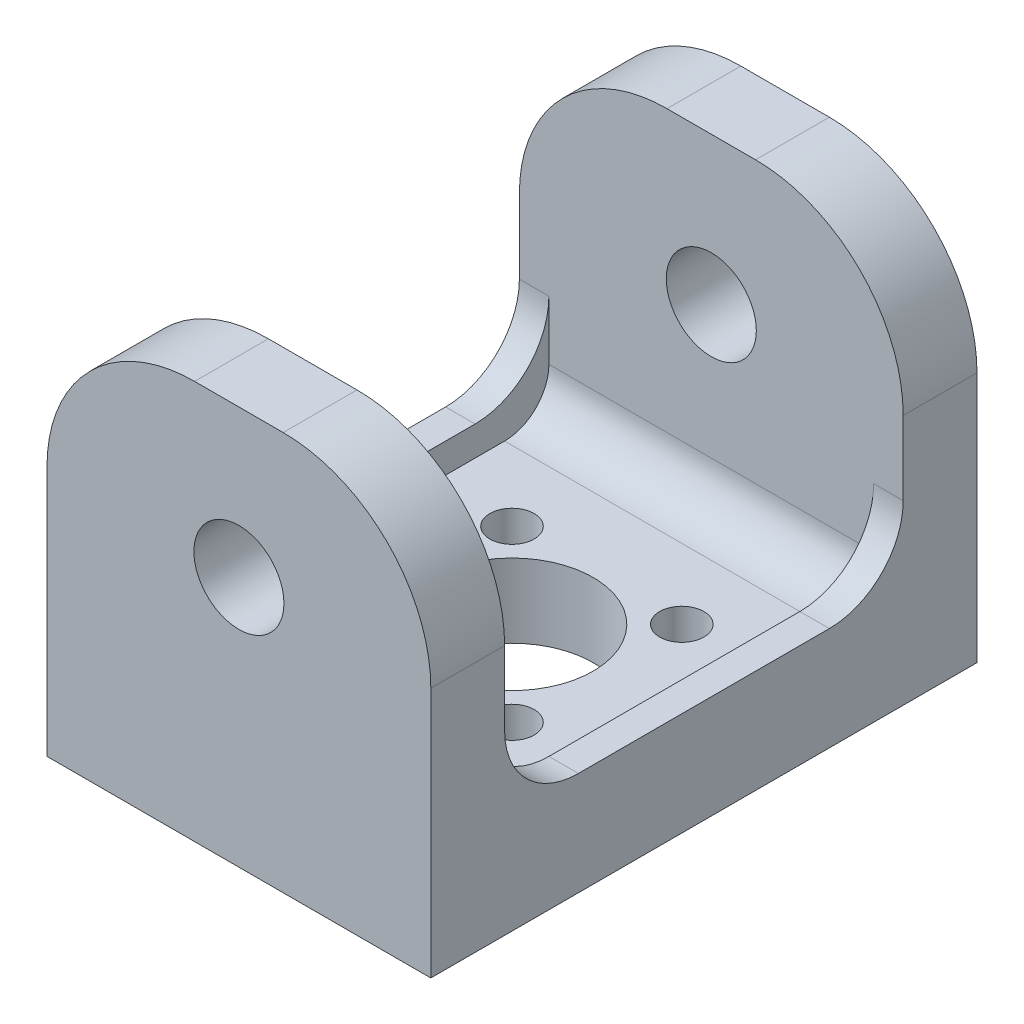
from build123d import *

# Parameters (mm, degrees)
SKETCH1_W               = 26
SKETCH1_H               = 37
BOSS_EXTRUDE1_DEPTH     = 5
SKETCH2_R               = 1.5
SKETCH2_R_2             = 5.5
CUT_EXTRUDE1_DEPTH      = 24.157072354
SKETCH3_W               = 26
SKETCH3_H               = 5
BOSS_EXTRUDE2_DEPTH     = 27
CUT_EXTRUDE2_DEPTH      = 36.217183306
CUT_EXTRUDE2_DEPTH_BACK = 36.217183306
SKETCH4_R               = 3.05
FILLET1_R               = 10
FILLET2_R               = 3
SKETCH5_W               = 2
SKETCH5_H               = 37
BOSS_EXTRUDE3_DEPTH     = 7
FILLET3_R               = 5


with BuildPart() as part:
    # Sketch1 → Boss-Extrude1 (new body)
    with BuildSketch(Plane(origin=(0, 0, 0), x_dir=(1, 0, 0), z_dir=(0, 1, 0))):
        Rectangle(SKETCH1_W, SKETCH1_H)
    extrude(amount=BOSS_EXTRUDE1_DEPTH)

    # Sketch2 → Cut-Extrude1 (cut, through all)
    with BuildSketch(Plane(origin=(0, 0, 0), x_dir=(1, 0, 0), z_dir=(0, 1, 0))):
        with Locations(Location((-5.75, 5.75, 0), (0, 0, 270))):
            Circle(SKETCH2_R)
        with Locations(Location((0, 0, 0), (0, 0, 270))):
            Circle(SKETCH2_R_2)
        with Locations(Location((5.75, 5.75, 0), (0, 0, 270))):
            Circle(SKETCH2_R)
        with Locations(Location((5.75, -5.75, 0), (0, 0, 270))):
            Circle(SKETCH2_R)
        with Locations(Location((-5.75, -5.75, 0), (0, 0, 270))):
            Circle(SKETCH2_R)
    extrude(amount=CUT_EXTRUDE1_DEPTH, mode=Mode.SUBTRACT)

    # Sketch3 → Boss-Extrude2 (add)
    with BuildSketch(Plane(origin=(0, 0, 0), x_dir=(1, 0, 0), z_dir=(0, 1, 0))):
        with Locations((0, 16)):
            Rectangle(SKETCH3_W, SKETCH3_H)
        with Locations((0, -16)):
            Rectangle(SKETCH3_W, SKETCH3_H)
    extrude(amount=BOSS_EXTRUDE2_DEPTH)

    # Sketch4 → Cut-Extrude2 (cut, two sides: drawn at the far end of the back side and taken through both)
    with BuildSketch(Plane.XY.offset(-CUT_EXTRUDE2_DEPTH_BACK)):
        with Locations((0, 17)):
            Circle(SKETCH4_R)
    extrude(amount=CUT_EXTRUDE2_DEPTH + CUT_EXTRUDE2_DEPTH_BACK, mode=Mode.SUBTRACT)

    # Fillet1
    fillet1_edges = [part.edges().sort_by_distance(p)[0] for p in [
        (-13, 27, -16),
        (13, 27, -16),
        (13, 27, 16),
        (-13, 27, 16),
    ]]
    fillet(fillet1_edges, radius=FILLET1_R)

    # Fillet2
    fillet2_edges = [part.edges().sort_by_distance(p)[0] for p in [
        (0, 5, -13.5),
        (0, 5, 13.5),
    ]]
    fillet(fillet2_edges, radius=FILLET2_R)

    # Sketch5 → Boss-Extrude3 (add)
    with BuildSketch(Plane(origin=(0, 0, 0), x_dir=(1, 0, 0), z_dir=(0, 1, 0))):
        with Locations((-12, 0)):
            Rectangle(SKETCH5_W, SKETCH5_H)
        with Locations((12, 0)):
            Rectangle(SKETCH5_W, SKETCH5_H)
    extrude(amount=BOSS_EXTRUDE3_DEPTH)

    # Fillet3
    # the kernel refuses this fillet: 5 mm, written as the material it adds along each edge
    with BuildSketch(Plane(origin=(13, 7, -13.328427125), x_dir=(0, 0, 1), z_dir=(-1, 0, 0))) as fillet3_piece_1:
        with BuildLine():
            CenterArc((4.828427125, 5), FILLET3_R, 180, 90)
            Line((-0.171572875, 5), (-0.671572875, 5))
            ThreePointArc((-0.671572875, 5), (-0.671572875, 1), (-0.471404521, -0.166666667))
            Line((-0.471404521, -0.166666667), (0, -0.5))
            Line((0, -0.5), (4.828427125, -0.5))
            Line((4.828427125, -0.5), (4.828427125, 0))
        make_face()
    extrude(amount=2)
    with BuildSketch(Plane(origin=(13, 7, 13.328427125), x_dir=(0, 0, -1), z_dir=(-1, 0, 0)), Plane(origin=(-11, 7, 13.328427125), x_dir=(0, 0, -1), z_dir=(-1, 0, 0))) as fillet3_piece_2:
        with BuildLine():
            CenterArc((4.828427125, -5), FILLET3_R, 90, 90)
            Line((-0.171572875, -5), (-0.671572875, -5))
            ThreePointArc((-0.671572875, -5), (-0.671572875, -1), (-0.471404521, 0.166666667))
            Line((-0.471404521, 0.166666667), (0, 0.5))
            Line((0, 0.5), (4.828427125, 0.5))
            Line((4.828427125, 0.5), (4.828427125, 0))
        make_face()
    extrude(amount=2)
    with BuildSketch(Plane(origin=(-11, 7, -13.328427125), x_dir=(0, 0.9994117743909562, -0.03429439033895371), z_dir=(-1, 0, 0))) as fillet3_piece_3:
        with BuildLine():
            CenterArc((4.831470907, -4.997058872), FILLET3_R, 88.034690809, 90)
            Line((-0.165587965, -4.82558692), (-0.665293852, -4.808439725))
            Line((-0.665293852, -4.808439725), (-0.499705887, 0.017147195))
            Line((-0.499705887, 0.017147195), (-0.150402098, 0.47684296))
            ThreePointArc((-0.150402098, 0.47684296), (1.022442957, 0.636883449), (5.020090054, 0.499705887))
            Line((5.020090054, 0.499705887), (5.002942859, 0))
        make_face()
    extrude(amount=2)


solid = part.part
